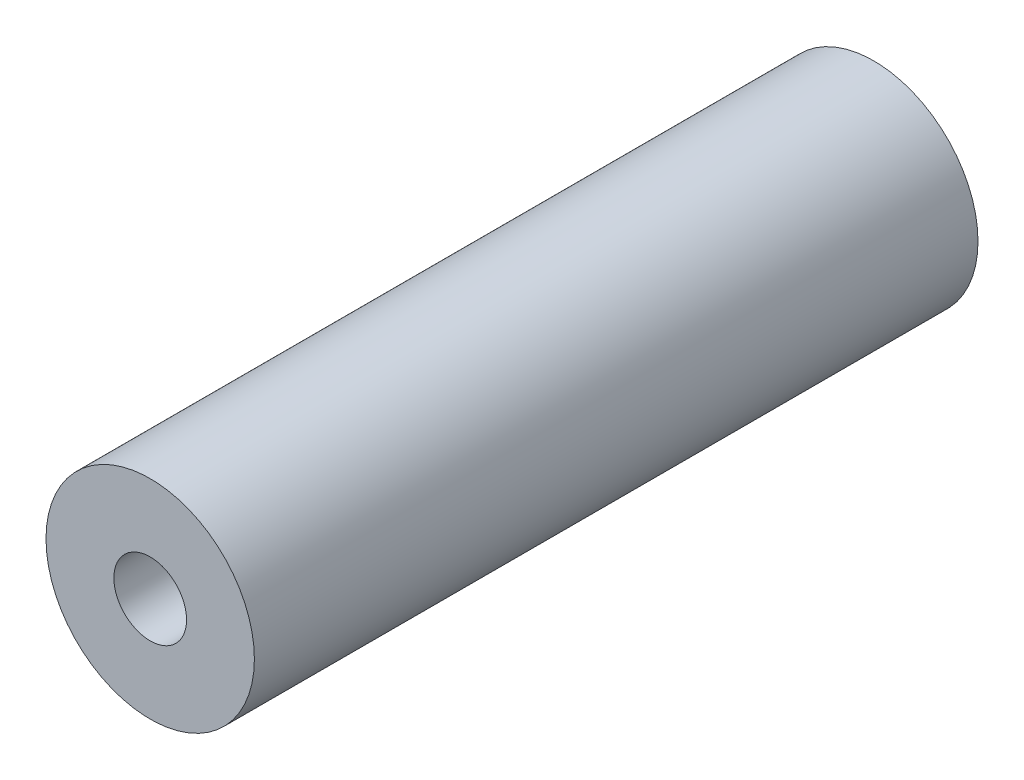
from build123d import *

# Parameters (mm, degrees)
SKETCH1_R           = 7.3152
SKETCH1_R_2         = 2.5527
BOSS_EXTRUDE1_DEPTH = 50.8


with BuildPart() as part:
    # Sketch1 → Boss-Extrude1 (new body)
    with BuildSketch(Plane.XY):
        Circle(SKETCH1_R)
        Circle(SKETCH1_R_2, mode=Mode.SUBTRACT)
    extrude(amount=BOSS_EXTRUDE1_DEPTH)


solid = part.part
